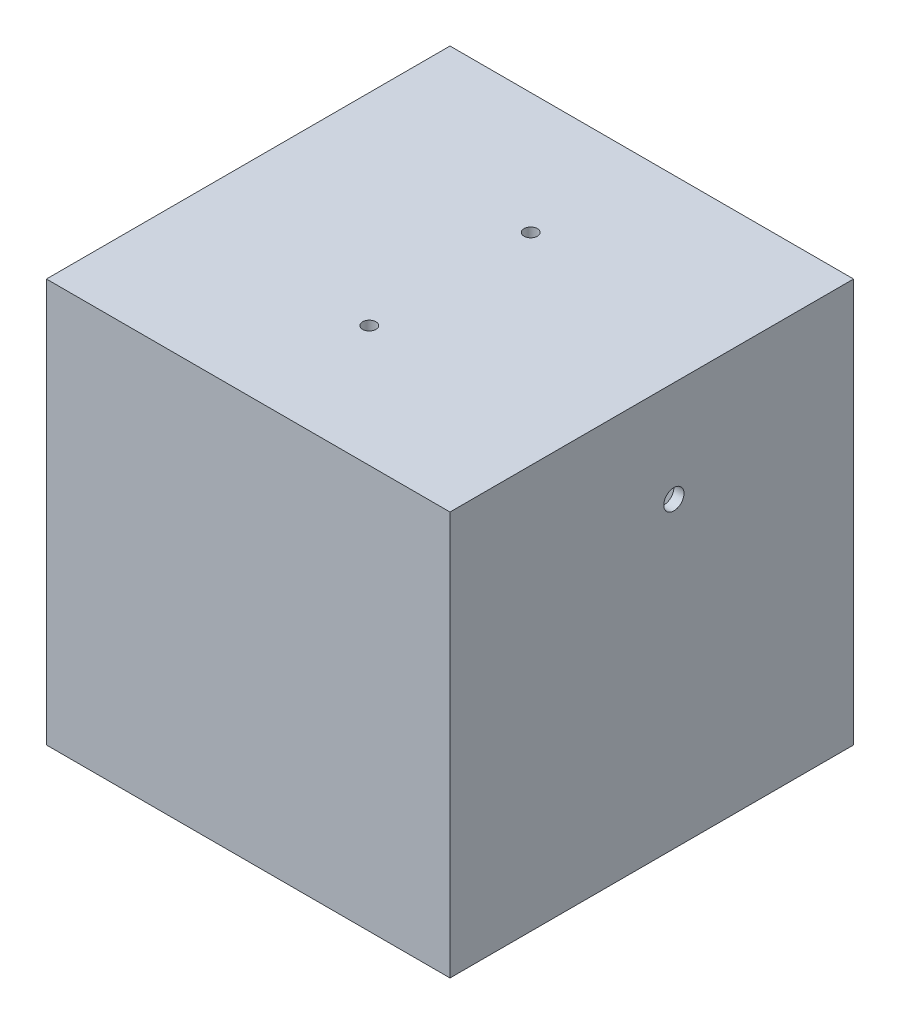
from build123d import *

# Parameters (mm, degrees)
SKETCH_1_W          = 200
SKETCH_1_H          = 200
EXTRUDE_1_DEPTH     = 5
SKETCH_3_W          = 200
SKETCH_3_H          = 200
SKETCH_3_W_2        = 190
SKETCH_3_H_2        = 190
EXTRUDE_2_DEPTH     = 190
SKETCH_4_W          = 200
SKETCH_4_H          = 200
SKETCH_4_R          = 70
EXTRUDE_3_DEPTH     = 5
SKETCH_5_R          = 3.3
CUT_EXTRUDE_1_DEPTH = 5
SKETCH_7_R          = 5
CUT_EXTRUDE_2_DEPTH = 344.547667726


with BuildPart() as part:
    # 草图1 → 凸台-拉伸1 (new body)
    with BuildSketch(Plane(origin=(0, 0, 0), x_dir=(1, 0, 0), z_dir=(0, 1, 0))):
        with Locations((100, 100)):
            Rectangle(SKETCH_1_W, SKETCH_1_H)
    extrude(amount=EXTRUDE_1_DEPTH)

    # 草图3 → 凸台-拉伸2 (add)
    with BuildSketch(Plane.XZ):
        with Locations((100, -100)):
            Rectangle(SKETCH_3_W, SKETCH_3_H)
        with Locations((100, -100)):
            Rectangle(SKETCH_3_W_2, SKETCH_3_H_2, mode=Mode.SUBTRACT)
    extrude(amount=EXTRUDE_2_DEPTH)

    # 草图4 → 凸台-拉伸3 (add)
    with BuildSketch(Plane.XZ.offset(190)):
        with Locations((100, -100)):
            Rectangle(SKETCH_4_W, SKETCH_4_H)
        with Locations((100, -100)):
            Circle(SKETCH_4_R, mode=Mode.SUBTRACT)
    extrude(amount=EXTRUDE_3_DEPTH)

    # 草图5 → 切除-拉伸1 (cut)
    with BuildSketch(Plane(origin=(0, 5, 0), x_dir=(1, 0, 0), z_dir=(0, 1, 0))):
        with Locations((100, 140)):
            Circle(SKETCH_5_R)
        with Locations((100, 60)):
            Circle(SKETCH_5_R)
    extrude(amount=-CUT_EXTRUDE_1_DEPTH, mode=Mode.SUBTRACT)

    # 草图7 → 切除-拉伸2 (cut, through all)
    with BuildSketch(Plane(origin=(200, 0, 0), x_dir=(0, 0, -1), z_dir=(1, 0, 0))):
        with Locations((110.95, -45)):
            Circle(SKETCH_7_R)
    extrude(amount=-CUT_EXTRUDE_2_DEPTH, mode=Mode.SUBTRACT)


solid = part.part
